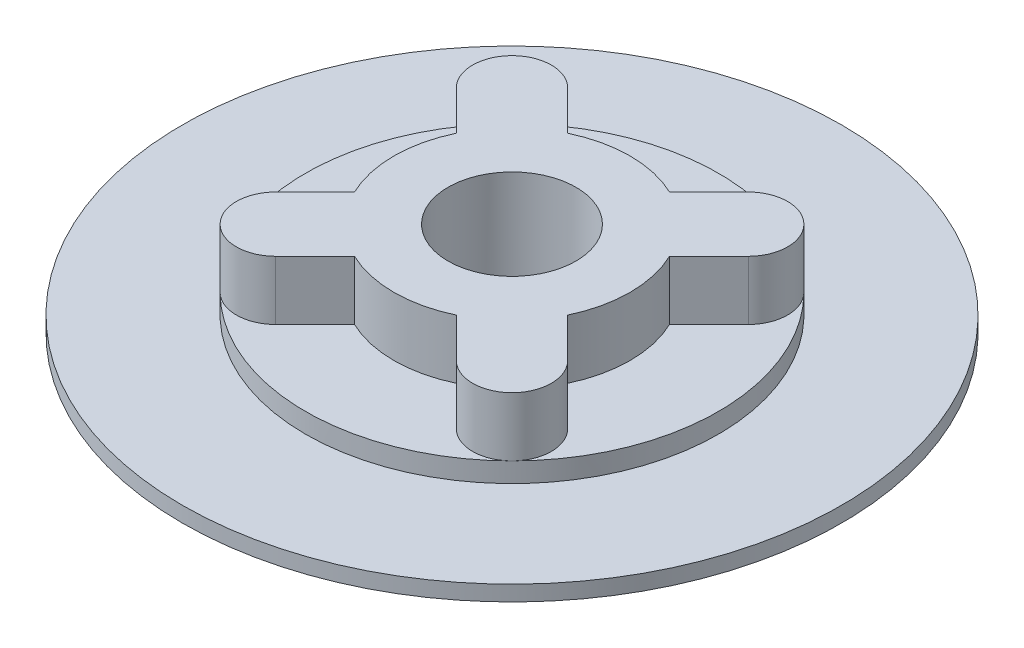
from build123d import *

# Parameters (mm, degrees)
SKETCH1_R           = 53.147403494
BOSS_EXTRUDE1_DEPTH = 2.4892
BOSS_EXTRUDE2_DEPTH = 12.7
SKETCH3_R           = 33.290768363
BOSS_EXTRUDE3_DEPTH = 3.175
SKETCH4_R           = 10.31875
CUT_EXTRUDE1_DEPTH  = 77.681189303
BOSS_EXTRUDE4_START = 3.175
SKETCH5_R           = 10.31875
BOSS_EXTRUDE4_DEPTH = 3.175


with BuildPart() as part:
    # Sketch1 → Boss-Extrude1 (new body)
    with BuildSketch(Plane(origin=(0, 0, 0), x_dir=(1, 0, 0), z_dir=(0, 1, 0))):
        Circle(SKETCH1_R)
    extrude(amount=BOSS_EXTRUDE1_DEPTH)

    # Sketch2 → Boss-Extrude2 (add)
    with BuildSketch(Plane(origin=(0, 2.4892, 0), x_dir=(1, 0, 0), z_dir=(0, 1, 0))):
        with BuildLine():
            Line((-8.209871939, 17.190128061), (-14.559871939, 23.540128061))
            ThreePointArc((-14.559871939, 23.540128061), (-23.540128061, 23.540128061), (-23.540128061, 14.559871939))
            Line((-23.540128061, 14.559871939), (-17.190128061, 8.209871939))
            ThreePointArc((-17.190128061, 8.209871939), (-19.05, 0), (-17.190128061, -8.209871939))
            Line((-17.190128061, -8.209871939), (-23.540128061, -14.559871939))
            ThreePointArc((-23.540128061, -14.559871939), (-23.540128061, -23.540128061), (-14.559871939, -23.540128061))
            Line((-14.559871939, -23.540128061), (-8.209871939, -17.190128061))
            ThreePointArc((-8.209871939, -17.190128061), (0, -19.05), (8.209871939, -17.190128061))
            Line((8.209871939, -17.190128061), (14.559871939, -23.540128061))
            ThreePointArc((14.559871939, -23.540128061), (23.540128061, -23.540128061), (23.540128061, -14.559871939))
            Line((23.540128061, -14.559871939), (17.190128061, -8.209871939))
            ThreePointArc((17.190128061, -8.209871939), (19.05, 0), (17.190128061, 8.209871939))
            Line((17.190128061, 8.209871939), (23.540128061, 14.559871939))
            ThreePointArc((23.540128061, 14.559871939), (23.540128061, 23.540128061), (14.559871939, 23.540128061))
            Line((14.559871939, 23.540128061), (8.209871939, 17.190128061))
            ThreePointArc((8.209871939, 17.190128061), (0, 19.05), (-8.209871939, 17.190128061))
        make_face()
    extrude(amount=BOSS_EXTRUDE2_DEPTH)

    # Sketch3 → Boss-Extrude3 (add)
    with BuildSketch(Plane(origin=(0, 2.4892, 0), x_dir=(1, 0, 0), z_dir=(0, 1, 0))):
        Circle(SKETCH3_R)
    extrude(amount=BOSS_EXTRUDE3_DEPTH)

    # Sketch4 → Cut-Extrude1 (cut, through all)
    with BuildSketch(Plane(origin=(0, 15.1892, 0), x_dir=(1, 0, 0), z_dir=(0, 1, 0))):
        Circle(SKETCH4_R)
    extrude(amount=-CUT_EXTRUDE1_DEPTH, mode=Mode.SUBTRACT)

    # Sketch5 → Boss-Extrude4 (add)
    with BuildSketch(Plane.XZ.offset(BOSS_EXTRUDE4_START)):
        with BuildLine():
            ThreePointArc((33.290768363, 0), (12.739825503, 30.756659512), (-23.540128061, 23.540128061))
            ThreePointArc((-23.540128061, 23.540128061), (-33.290768363, 0), (-23.540128061, -23.540128061))
            ThreePointArc((-23.540128061, -23.540128061), (12.739825503, -30.756659512), (33.290768363, 0))
        make_face()
        Circle(SKETCH5_R, mode=Mode.SUBTRACT)
    extrude(amount=-BOSS_EXTRUDE4_DEPTH)


solid = part.part
